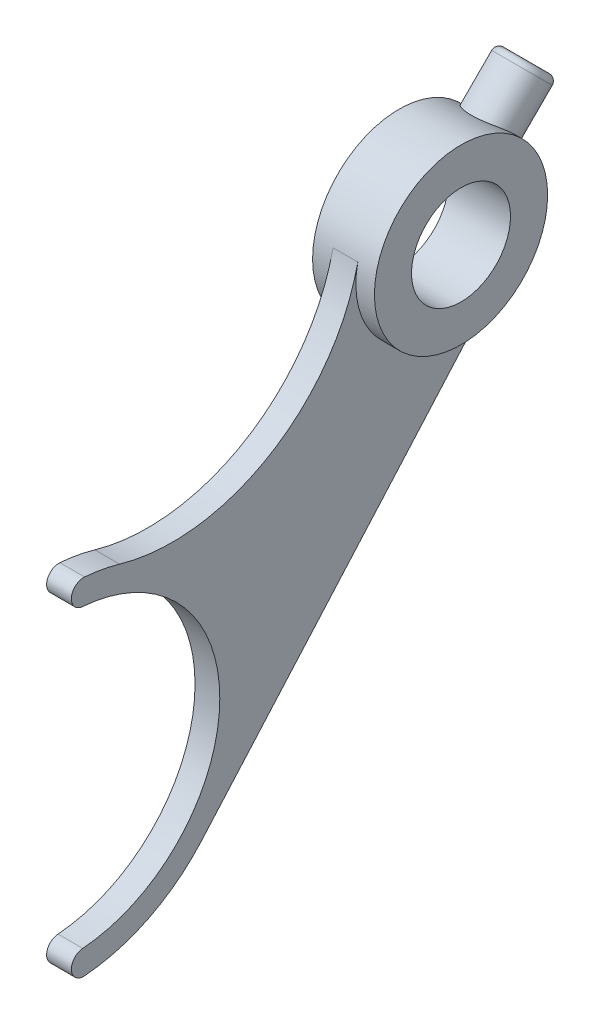
from build123d import *

# Parameters (mm, degrees)
BOSS_EXTRUDE1_DEPTH     = 1
SKETCH1_3_R             = 7
SKETCH1_3_R_2           = 4
BOSS_EXTRUDE2_DEPTH     = 2.5
BOSS_EXTRUDE3_DEPTH     = 2
CUT_EXTRUDE1_REACH      = 61.611
CUT_EXTRUDE1_END_RADIUS = 7
FILLET1_R               = 0.5
FILLET2_START           = -2
FILLET2_DEPTH           = 4
FILLET3_START           = -2
FILLET3_DEPTH           = 4


with BuildPart() as part:
    # Sketch1 → Boss-Extrude1 (new, symmetric)
    with BuildSketch(Plane.YZ):
        with BuildLine():
            Line((-9.247850598, -10.510816301), (18.876074701, -35.255408151))
            ThreePointArc((18.876074701, -35.255408151), (17.246857686, -26.853857727), (24.964224943, -23.154852426))
            ThreePointArc((24.964224943, -23.154852426), (15.014290028, -16.032467293), (13.446719603, -3.896887464))
            ThreePointArc((13.446719603, -3.896887464), (13.860989763, -1.967984445), (14, 0))
            Line((14, 0), (12, 0))
            ThreePointArc((12, 0), (0, -12), (-12, 0))
            Line((-12, 0), (-14, 0))
            ThreePointArc((-14, 0), (-12.756761117, -5.767585788), (-9.247850598, -10.510816301))
        make_face()
    extrude(amount=BOSS_EXTRUDE1_DEPTH, both=True)

    # Sketch1<3> → Boss-Extrude2 (add, symmetric)
    with BuildSketch(Plane.YZ):
        with Locations(Location((23.5, -30, 0), (0, 0, 270))):
            Circle(SKETCH1_3_R)
        with Locations(Location((23.5, -30, 0), (0, 0, 270))):
            Circle(SKETCH1_3_R_2, mode=Mode.SUBTRACT)
    extrude(amount=BOSS_EXTRUDE2_DEPTH, both=True)

    # Sketch1<4> → Boss-Extrude3 (add, symmetric)
    with BuildSketch(Plane.YZ):
        with BuildLine():
            ThreePointArc((29.657630053, -33.329202928), (29.11248608, -34.183300133), (28.449747468, -34.949747468))
            Line((28.449747468, -34.949747468), (31.278174593, -37.778174593))
            Line((31.278174593, -37.778174593), (32.692388155, -36.363961031))
            Line((32.692388155, -36.363961031), (29.657630053, -33.329202928))
        make_face()
        with BuildLine():
            ThreePointArc((28.449747468, -34.949747468), (27.683300133, -35.61248608), (26.829202928, -36.157630053))
            Line((26.829202928, -36.157630053), (29.863961031, -39.192388155))
            Line((29.863961031, -39.192388155), (31.278174593, -37.778174593))
            Line((31.278174593, -37.778174593), (28.449747468, -34.949747468))
        make_face()
    extrude(amount=BOSS_EXTRUDE3_DEPTH, both=True)

    # Cut-Extrude1: up to this cylinder (the profile starts outside it)
    cut_extrude1_end = Plane(origin=(0, 23.5, -30), z_dir=(-1, 0, 0)) * Cylinder(CUT_EXTRUDE1_END_RADIUS, 141.328528, mode=Mode.PRIVATE)
    # Sketch2 → Cut-Extrude1 (cut, up to the surface)
    with BuildSketch(Plane(origin=(0, 34.528174593, -34.528174593), x_dir=(-1, 0, 0), z_dir=(0, 0.707106781186549, -0.7071067811865461)), mode=Mode.PRIVATE) as cut_extrude1_sk1:
        with BuildLine():
            ThreePointArc((-2, -4.596194078), (-1.414213562, -3.181980515), (0, -2.596194078))
            Line((0, -2.596194078), (-2, -2.596194078))
            Line((-2, -2.596194078), (-2, -4.596194078))
        make_face()
    cut_extrude1_tool1 = extrude(cut_extrude1_sk1.sketch, amount=-CUT_EXTRUDE1_REACH, mode=Mode.PRIVATE) - cut_extrude1_end
    add(cut_extrude1_tool1.solids().sort_by_distance((1.553264, 32.376498, -36.679851))[0], mode=Mode.SUBTRACT)
    # Sketch2 → Cut-Extrude1 (cut, up to the surface)
    with BuildSketch(Plane(origin=(0, 34.528174593, -34.528174593), x_dir=(-1, 0, 0), z_dir=(0, 0.707106781186549, -0.7071067811865461)), mode=Mode.PRIVATE) as cut_extrude1_sk2:
        with BuildLine():
            ThreePointArc((0, -2.596194078), (1.414213562, -3.181980515), (2, -4.596194078))
            Line((2, -4.596194078), (2, -2.596194078))
            Line((2, -2.596194078), (0, -2.596194078))
        make_face()
    cut_extrude1_tool2 = extrude(cut_extrude1_sk2.sketch, amount=-CUT_EXTRUDE1_REACH, mode=Mode.PRIVATE) - cut_extrude1_end
    add(cut_extrude1_tool2.solids().sort_by_distance((-1.553264, 32.376498, -36.679851))[0], mode=Mode.SUBTRACT)
    # Sketch2 → Cut-Extrude1 (cut, up to the surface)
    with BuildSketch(Plane(origin=(0, 34.528174593, -34.528174593), x_dir=(-1, 0, 0), z_dir=(0, 0.707106781186549, -0.7071067811865461)), mode=Mode.PRIVATE) as cut_extrude1_sk3:
        with BuildLine():
            Line((1.9e-08, -6.596194078), (2, -6.596194078))
            Line((2, -6.596194078), (2, -4.596194078))
            ThreePointArc((2, -4.596194078), (1.414213569, -6.010407633), (1.9e-08, -6.596194078))
        make_face()
    cut_extrude1_tool3 = extrude(cut_extrude1_sk3.sketch, amount=-CUT_EXTRUDE1_REACH, mode=Mode.PRIVATE) - cut_extrude1_end
    add(cut_extrude1_tool3.solids().sort_by_distance((-1.553264, 30.179851, -38.876498))[0], mode=Mode.SUBTRACT)
    # Sketch2 → Cut-Extrude1 (cut, up to the surface)
    with BuildSketch(Plane(origin=(0, 34.528174593, -34.528174593), x_dir=(-1, 0, 0), z_dir=(0, 0.707106781186549, -0.7071067811865461)), mode=Mode.PRIVATE) as cut_extrude1_sk4:
        with BuildLine():
            Line((-2, -6.596194078), (1.9e-08, -6.596194078))
            ThreePointArc((1.9e-08, -6.596194078), (-1.414213556, -6.010407647), (-2, -4.596194078))
            Line((-2, -4.596194078), (-2, -6.596194078))
        make_face()
    cut_extrude1_tool4 = extrude(cut_extrude1_sk4.sketch, amount=-CUT_EXTRUDE1_REACH, mode=Mode.PRIVATE) - cut_extrude1_end
    add(cut_extrude1_tool4.solids().sort_by_distance((1.553264, 30.179851, -38.876498))[0], mode=Mode.SUBTRACT)

    # Fillet1
    fillet1_edges = [part.edges().sort_by_distance(p)[0] for p in [
        (0, 29.863961031, -39.192388155),
    ]]
    fillet(fillet1_edges, radius=FILLET1_R)

    # Fillet2: read off the stored shape, not the designer's step
    # Fillet2 outline → Fillet2 (cut)
    with BuildSketch(Plane.YZ.offset(FILLET2_START)):
        with BuildLine():
            ThreePointArc((-14, 0), (-13.989625763, -0.538860843), (-13.958518428, -1.076923077))
            add(Edge.make_bspline(
                [(-13.958518428, -1.076923077), (-13.978684128, -0.815545726), (-13.917861816, -0.505978869), (-13.724957355, -0.19992372), (-13.383008233, 5e-09), (-12.961481386, 0)],
                knots=[0, 0, 0, 0, 0, 0, 0.519259304, 0.519259304, 0.519259304, 0.519259304, 0.519259304, 0.519259304], degree=5, weights=[1, 0.792296278, 0.638518602, 0.53866697, 0.492741383, 0.500741842]))
            Line((-12.961481386, 0), (-14, 0))
        make_face()
        with BuildLine():
            Line((-12, 0), (-12.961481386, 0))
            add(Edge.make_bspline(
                [(-12.961481386, 0), (-12.583056271, -4e-09), (-12.270553606, -0.164313436), (-12.073438627, -0.418546888), (-11.982758039, -0.685704598), (-11.964444366, -0.923076923)],
                knots=[0.519259304, 0.519259304, 0.519259304, 0.519259304, 0.519259304, 0.519259304, 1, 1, 1, 1, 1, 1], degree=5, weights=[0.500741842, 0.508148827, 0.561778135, 0.661629767, 0.807703722, 1]))
            ThreePointArc((-11.964444366, -0.923076923), (-11.991107797, -0.461880723), (-12, 0))
        make_face()
    extrude(amount=FILLET2_DEPTH, mode=Mode.SUBTRACT)

    # Fillet3: read off the stored shape, not the designer's step
    # Fillet3 outline → Fillet3 (cut)
    with BuildSketch(Plane.YZ.offset(FILLET3_START)):
        with BuildLine():
            ThreePointArc((12, 0), (11.991107797, -0.461880723), (11.964444366, -0.923076923))
            add(Edge.make_bspline(
                [(11.964444366, -0.923076923), (11.982758039, -0.685704597), (12.073438628, -0.418546886), (12.270553609, -0.164313433), (12.583056275, -2e-09), (12.961481392, 0)],
                knots=[0, 0, 0, 0, 0, 0, 0.480740697, 0.480740697, 0.480740697, 0.480740697, 0.480740697, 0.480740697], degree=5, weights=[1, 0.807703721, 0.661629766, 0.561778134, 0.508148826, 0.500741841]))
            Line((12.961481392, 0), (12, 0))
        make_face()
        with BuildLine():
            Line((14, 0), (12.961481392, 0))
            add(Edge.make_bspline(
                [(12.961481392, 0), (13.383008238, 2e-09), (13.724957357, -0.199923723), (13.917861817, -0.505978871), (13.978684128, -0.815545728), (13.958518427, -1.076923077)],
                knots=[0.480740697, 0.480740697, 0.480740697, 0.480740697, 0.480740697, 0.480740697, 1, 1, 1, 1, 1, 1], degree=5, weights=[0.500741841, 0.492741384, 0.538666971, 0.638518602, 0.792296279, 1]))
            ThreePointArc((13.958518427, -1.076923077), (13.989625763, -0.538860843), (14, 0))
        make_face()
    extrude(amount=FILLET3_DEPTH, mode=Mode.SUBTRACT)


solid = part.part
